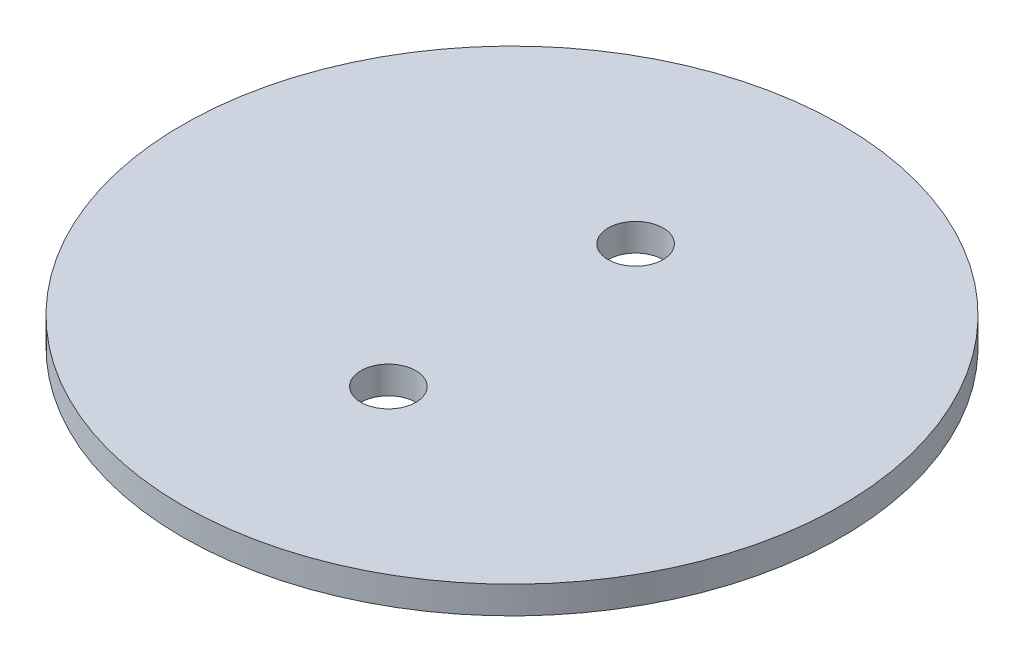
from build123d import *

# Parameters (mm, degrees)
SKETCH1_R           = 36
BOSS_EXTRUDE1_DEPTH = 3


with BuildPart() as part:
    # Sketch1 → Boss-Extrude1 (new body)
    with BuildSketch(Plane(origin=(0, 0, 0), x_dir=(1, 0, 0), z_dir=(0, 1, 0))):
        Circle(SKETCH1_R)
        with BuildLine():
            ThreePointArc((3, -13.5), (-2.121320344, -15.621320344), (0, -10.5))
            ThreePointArc((0, -10.5), (2.121320344, -11.378679656), (3, -13.5))
        make_face(mode=Mode.SUBTRACT)
        with BuildLine():
            ThreePointArc((3, 13.5), (2.121320344, 11.378679656), (0, 10.5))
            ThreePointArc((0, 10.5), (-2.121320344, 15.621320344), (3, 13.5))
        make_face(mode=Mode.SUBTRACT)
    extrude(amount=-BOSS_EXTRUDE1_DEPTH)


solid = part.part
